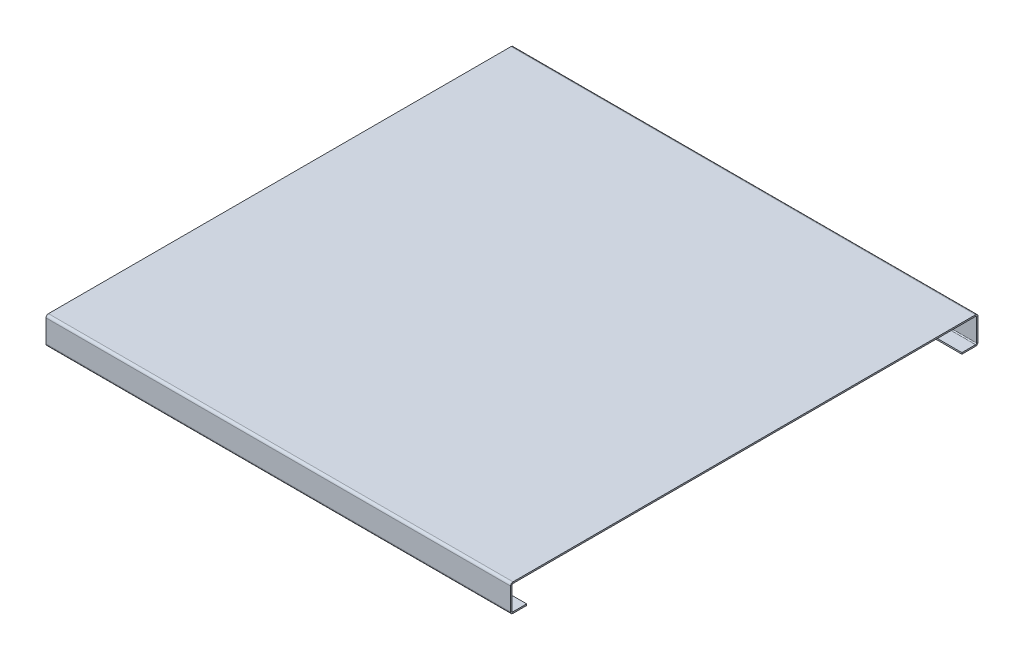
from build123d import *

# Parameters (mm, degrees)
BASE_FLANGIA1_DEPTH = 950


# Sheet-metal steps are written as plain solids
with BuildPart() as part:
    # Schizzo1 → Base-Flangia1 (new body)
    with BuildSketch(Plane(origin=(0, 0, 0), x_dir=(0, 0, -1), z_dir=(1, 0, 0))):
        with BuildLine():
            Line((30, -50), (2, -50))
            ThreePointArc((2, -50), (0.585786438, -49.414213562), (0, -48))
            Line((0, -48), (0, -2))
            ThreePointArc((0, -2), (0.585786438, -0.585786438), (2, 0))
            Line((2, 0), (948, 0))
            ThreePointArc((948, 0), (949.414213562, -0.585786438), (950, -2))
            Line((950, -2), (950, -48))
            ThreePointArc((950, -48), (949.414213562, -49.414213562), (948, -50))
            Line((948, -50), (920, -50))
            Line((920, -50), (920, -53))
            Line((920, -53), (948, -53))
            ThreePointArc((948, -53), (951.535533906, -51.535533906), (953, -48))
            Line((953, -48), (953, -2))
            ThreePointArc((953, -2), (951.535533906, 1.535533906), (948, 3))
            Line((948, 3), (2, 3))
            ThreePointArc((2, 3), (-1.535533906, 1.535533906), (-3, -2))
            Line((-3, -2), (-3, -48))
            ThreePointArc((-3, -48), (-1.535533906, -51.535533906), (2, -53))
            Line((2, -53), (30, -53))
            Line((30, -53), (30, -50))
        make_face()
    extrude(amount=BASE_FLANGIA1_DEPTH)


solid = part.part
